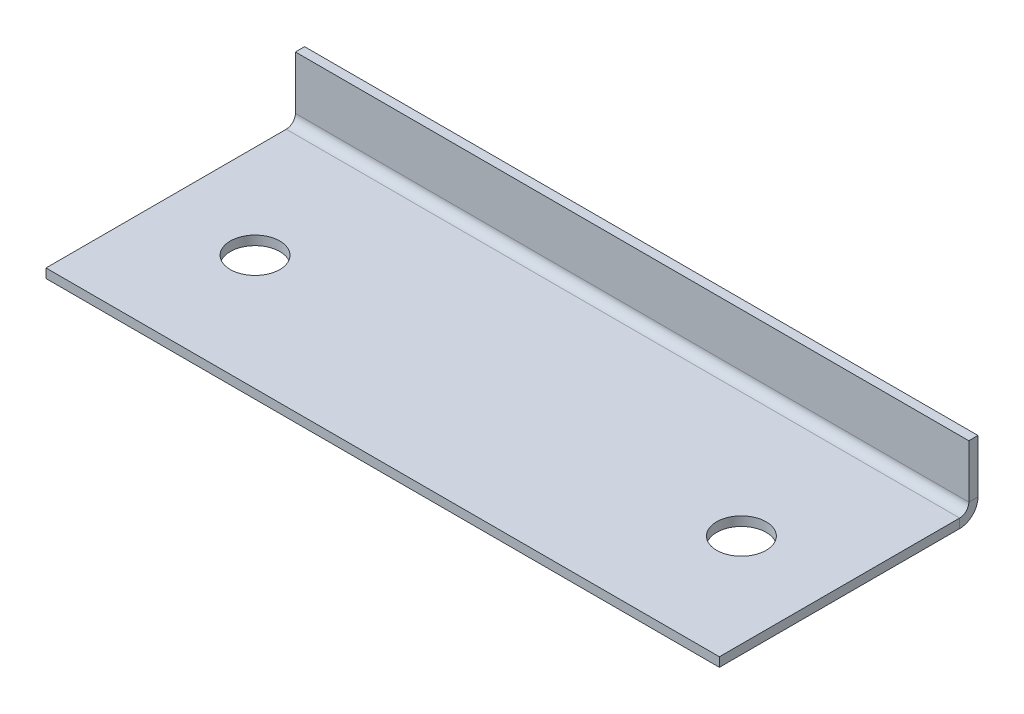
from build123d import *

# Parameters (mm, degrees)
BASE_FLANGE1_DEPTH = 54
SKETCH6_R          = 1.984375
CUT_EXTRUDE1_DEPTH = 56.283583274


# Sheet-metal steps are written as plain solids
with BuildPart() as part:
    # Sketch1 → Base-Flange1 (new body)
    with BuildSketch(Plane(origin=(0, 0, 0), x_dir=(0, 0, -1), z_dir=(1, 0, 0))):
        with BuildLine():
            Line((-10, 0), (9.2634, 0))
            ThreePointArc((9.2634, 0), (9.784254855, 0.215745145), (10, 0.7366))
            Line((10, 0.7366), (10, 5))
            Line((10, 5), (10.7366, 5))
            Line((10.7366, 5), (10.7366, 0.7366))
            ThreePointArc((10.7366, 0.7366), (10.30510971, -0.30510971), (9.2634, -0.7366))
            Line((9.2634, -0.7366), (-10, -0.7366))
            Line((-10, -0.7366), (-10, 0))
        make_face()
    extrude(amount=BASE_FLANGE1_DEPTH)

    # Sketch6 → Cut-Extrude1 (cut, through all)
    with BuildSketch(Plane(origin=(0, 0, 0), x_dir=(1, 0, 0), z_dir=(0, 1, 0))):
        with Locations(Location((7.5, -0.7366, 0), (0, 0, 270))):
            Circle(SKETCH6_R)
        with Locations(Location((46.5, -0.7366, 0), (0, 0, 270))):
            Circle(SKETCH6_R)
    extrude(amount=-CUT_EXTRUDE1_DEPTH, mode=Mode.SUBTRACT)


solid = part.part
